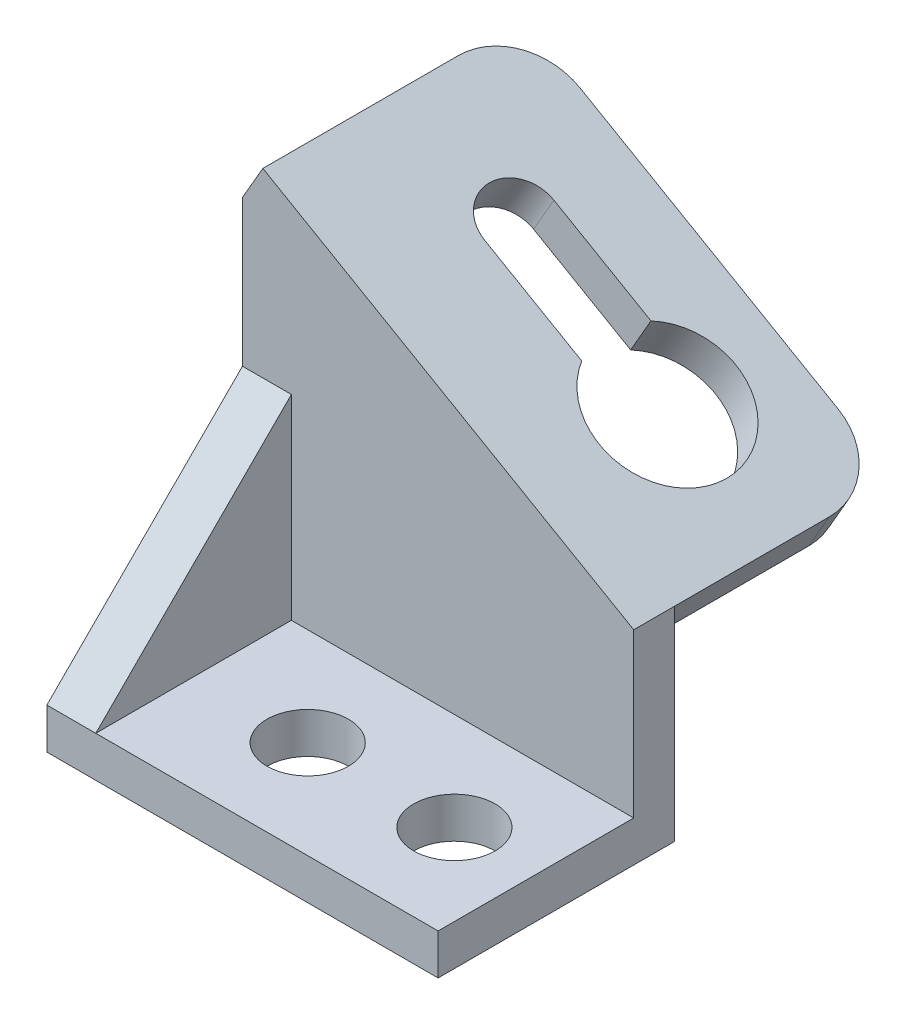
from build123d import *

# Parameters (mm, degrees)
BASE_EXTRUDE_THIN_DEPTH = 76.2
BOSS_EXTRUDE1_START     = -7.9375
BOSS_EXTRUDE1_DEPTH     = 7.9375
SKETCH3_W               = 87.988181024
SKETCH3_H               = 50.8
BOSS_EXTRUDE2_DEPTH     = 7.9375
CUT_EXTRUDE1_DEPTH      = 119.845476344
FILLET1_R               = 12.7
BOSS_EXTRUDE3_DEPTH     = 9.525
CUT_EXTRUDE2_DEPTH      = 100.992371073
SKETCH9_R               = 7.9375
CUT_EXTRUDE3_DEPTH      = 118.398397707
LPATTERN2_COUNT         = 2
LPATTERN2_PITCH         = 28.575


# Read off the part's stored shape, not the designer's step: Boss-Extrude1
with BuildPart() as part:
    # Sketch1 → Base-Extrude-Thin (new body)
    with BuildSketch(Plane(origin=(0, 0, 0), x_dir=(0, 0, -1), z_dir=(1, 0, 0))):
        Polygon((-38.1, 0), (0, 0), (0, 31.75), (7.9375, 31.75), (7.9375, -7.9375), (-38.1, -7.9375), align=None)
    extrude(amount=BASE_EXTRUDE_THIN_DEPTH)

    # Boss-Extrude1 outline → Boss-Extrude1 (add)
    with BuildSketch(Plane.XY.offset(BOSS_EXTRUDE1_START)):
        Polygon((76.2, 31.75), (0, 75.744090512), (0, 31.75), align=None)
    extrude(amount=BOSS_EXTRUDE1_DEPTH)

    # Sketch3 → Boss-Extrude2 (add)
    with BuildSketch(Plane(origin=(32.798153285, 56.808067884, 0), x_dir=(-0.8660254037844379, 0.5000000000000014, 0), z_dir=(0.5000000000000014, 0.8660254037844379, 0))):
        with Locations((-6.122045256, -25.4)):
            Rectangle(SKETCH3_W, SKETCH3_H)
    extrude(amount=-BOSS_EXTRUDE2_DEPTH)

    # Sketch4 → Cut-Extrude1 (cut, through all)
    with BuildSketch(Plane.XY):
        Polygon((-113.819682418, -130.562817861), (0, 66.578654989), (3.96875, 73.452731631), (117.788432418, 270.594204481), (-276.494513281, 498.233569317), (-508.102628117, 97.076546976), align=None)
    extrude(amount=-CUT_EXTRUDE1_DEPTH, mode=Mode.SUBTRACT)

    # Fillet1
    fillet1_edges = [part.edges().sort_by_distance(p)[0] for p in [
        (74.215625, 28.312961679, -50.8),
        (1.984375, 70.01569331, -50.8),
    ]]
    fillet(fillet1_edges, radius=FILLET1_R)

    # Sketch5 → Boss-Extrude3 (add)
    with BuildSketch(Plane.ZY):
        Polygon((0, 38.1), (0, 0), (38.1, 0), align=None)
    extrude(amount=-BOSS_EXTRUDE3_DEPTH)

    # Sketch6 → Cut-Extrude2 (cut, through all)
    with BuildSketch(Plane(origin=(24.654916237, 61.509567986, -0.61351416), x_dir=(-0.866025403784438, 0.5000000000000012, 0), z_dir=(0.5000000000000011, 0.8660254037844379, 0))):
        with BuildLine():
            Line((-0.781635971, -34.70836084), (-22.616879552, -34.70836084))
            ThreePointArc((-22.616879552, -34.70836084), (-47.454135971, -27.96148584), (-22.616879552, -21.21461084))
            Line((-22.616879552, -21.21461084), (-0.781635971, -21.21461084))
            ThreePointArc((-0.781635971, -21.21461084), (5.965239029, -27.96148584), (-0.781635971, -34.70836084))
        make_face()
    extrude(amount=-CUT_EXTRUDE2_DEPTH, mode=Mode.SUBTRACT)

    # Sketch9 → Cut-Extrude3 (cut, through all)
    with BuildSketch(Plane(origin=(0, 0, 0), x_dir=(-1, 0, 0), z_dir=(0, 1, 0))):
        with Locations(Location((-60.325, 19.05, 0), (0, 0, 90))):
            Circle(SKETCH9_R)
    cut_extrude3 = extrude(amount=-CUT_EXTRUDE3_DEPTH, mode=Mode.SUBTRACT)

    # LPattern2: Cut-Extrude3 ×2
    with Locations(*[(-i * LPATTERN2_PITCH, 0, 0) for i in range(1, LPATTERN2_COUNT)]):
        add(cut_extrude3, mode=Mode.SUBTRACT)


solid = part.part
